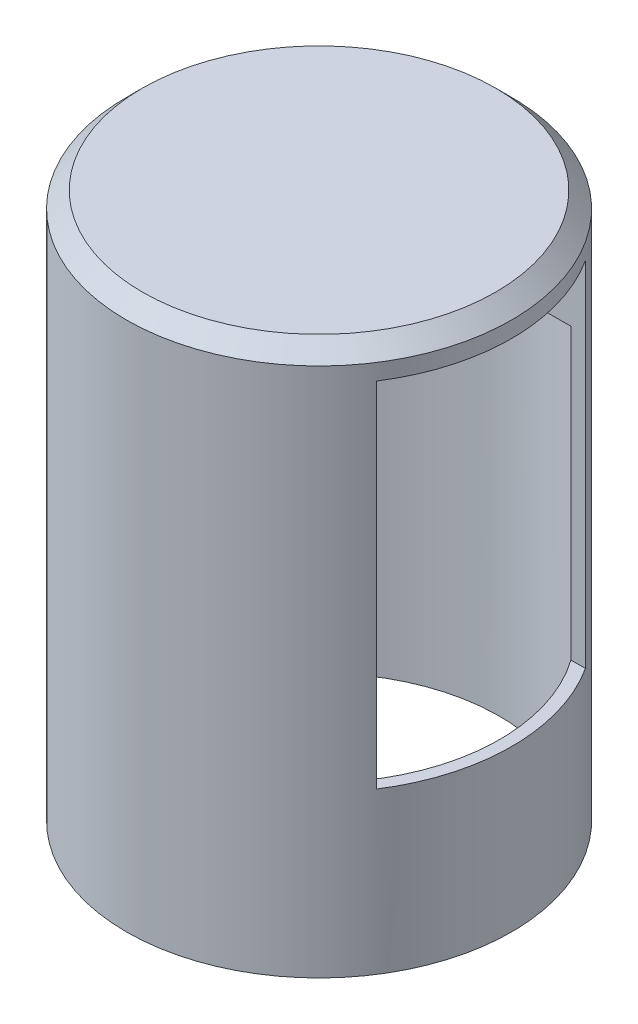
from build123d import *

# Parameters (mm, degrees)
BOSS_EXTRUDE1_DEPTH = 33
BOSS_EXTRUDE2_START = 32
BOSS_EXTRUDE2_DEPTH = 1
BOSS_EXTRUDE3_START = 33
SKETCH1_7_R         = 12
BOSS_EXTRUDE3_DEPTH = 1
CHAMFER1_SIZE       = 1
BOSS_EXTRUDE4_DEPTH = 10
BOSS_EXTRUDE5_START = 29
SKETCH1_9_W         = 2
SKETCH1_9_H         = 2
BOSS_EXTRUDE5_DEPTH = 4
BOSS_EXTRUDE6_START = 28
BOSS_EXTRUDE6_DEPTH = 5


with BuildPart() as part:
    # Sketch1 → Boss-Extrude1 (new body)
    with BuildSketch(Plane(origin=(0, 0, 0), x_dir=(1, 0, 0), z_dir=(0, 1, 0))):
        with BuildLine():
            ThreePointArc((7.383924434, -9.459263182), (8.859947089, -8.093289663), (10.087120501, -6.5))
            Line((10.087120501, -6.5), (9.182183836, -6.5))
            ThreePointArc((9.182183836, -6.5), (0, -11.25), (-9.182183836, -6.5))
            ThreePointArc((-9.182183836, -6.5), (-11.25, 0), (-9.182183836, 6.5))
            ThreePointArc((-9.182183836, 6.5), (0, 11.25), (9.182183836, 6.5))
            Line((9.182183836, 6.5), (10.087120501, 6.5))
            ThreePointArc((10.087120501, 6.5), (7.6512779, 9.244346732), (4.5, 11.124297731))
            ThreePointArc((4.5, 11.124297731), (0, 12), (-4.5, 11.124297731))
            ThreePointArc((-4.5, 11.124297731), (-10.392304845, 6), (-11.883924434, -1.665034548))
            ThreePointArc((-11.883924434, -1.665034548), (-10.392304845, -6), (-7.383924434, -9.459263182))
            ThreePointArc((-7.383924434, -9.459263182), (0, -12), (7.383924434, -9.459263182))
        make_face()
    extrude(amount=BOSS_EXTRUDE1_DEPTH)



with BuildPart() as body_2:
    # Sketch1<6> → Boss-Extrude2 (new body)
    with BuildSketch(Plane(origin=(0, 0, 0), x_dir=(1, 0, 0), z_dir=(0, 1, 0)).offset(BOSS_EXTRUDE2_START)):
        with BuildLine():
            ThreePointArc((10.087120501, -6.5), (11.248374399, -4.180200161), (11.883924434, -1.665034548))
            ThreePointArc((11.883924434, -1.665034548), (11.970945936, -0.834537834), (12, 0))
            ThreePointArc((12, 0), (11.511851415, 3.387813011), (10.087120501, 6.5))
            Line((10.087120501, 6.5), (9.182183836, 6.5))
            ThreePointArc((9.182183836, 6.5), (10.72058926, 3.410493501), (11.25, 0))
            ThreePointArc((11.25, 0), (10.72058926, -3.410493501), (9.182183836, -6.5))
            Line((9.182183836, -6.5), (10.087120501, -6.5))
        make_face()
    extrude(amount=BOSS_EXTRUDE2_DEPTH)


with BuildPart() as part_1:
    add(part.part)

    add(body_2.part)  # Boss-Extrude3 merges body 2
    # Sketch1<7> → Boss-Extrude3 (add)
    with BuildSketch(Plane(origin=(0, 0, 0), x_dir=(1, 0, 0), z_dir=(0, 1, 0)).offset(BOSS_EXTRUDE3_START)):
        with Locations(Location((0, 0, 0), (0, 0, 32.797168296))):
            Circle(SKETCH1_7_R)
    extrude(amount=BOSS_EXTRUDE3_DEPTH)

    # Chamfer1
    chamfer1_edges = [part_1.edges().sort_by_distance(p)[0] for p in [
        (-10.087120501, 34, 6.5),
    ]]
    chamfer(chamfer1_edges, length=CHAMFER1_SIZE - 0.0001)  # a hair under: the kernel refuses the full size

    # Sketch1<8> → Boss-Extrude4 (add)
    with BuildSketch(Plane(origin=(0, 0, 0), x_dir=(1, 0, 0), z_dir=(0, 1, 0))):
        with BuildLine():
            ThreePointArc((10.087120501, -6.5), (11.248374399, -4.180200161), (11.883924434, -1.665034548))
            ThreePointArc((11.883924434, -1.665034548), (11.970945936, -0.834537834), (12, 0))
            ThreePointArc((12, 0), (11.511851415, 3.387813011), (10.087120501, 6.5))
            Line((10.087120501, 6.5), (9.182183836, 6.5))
            ThreePointArc((9.182183836, 6.5), (10.72058926, 3.410493501), (11.25, 0))
            ThreePointArc((11.25, 0), (10.72058926, -3.410493501), (9.182183836, -6.5))
            Line((9.182183836, -6.5), (10.087120501, -6.5))
        make_face()
        with BuildLine():
            ThreePointArc((7.383924434, -9.459263182), (8.859947089, -8.093289663), (10.087120501, -6.5))
            Line((10.087120501, -6.5), (9.182183836, -6.5))
            ThreePointArc((9.182183836, -6.5), (0, -11.25), (-9.182183836, -6.5))
            ThreePointArc((-9.182183836, -6.5), (-11.25, 0), (-9.182183836, 6.5))
            ThreePointArc((-9.182183836, 6.5), (0, 11.25), (9.182183836, 6.5))
            Line((9.182183836, 6.5), (10.087120501, 6.5))
            ThreePointArc((10.087120501, 6.5), (7.6512779, 9.244346732), (4.5, 11.124297731))
            ThreePointArc((4.5, 11.124297731), (0, 12), (-4.5, 11.124297731))
            ThreePointArc((-4.5, 11.124297731), (-10.392304845, 6), (-11.883924434, -1.665034548))
            ThreePointArc((-11.883924434, -1.665034548), (-10.392304845, -6), (-7.383924434, -9.459263182))
            ThreePointArc((-7.383924434, -9.459263182), (0, -12), (7.383924434, -9.459263182))
        make_face()
    extrude(amount=BOSS_EXTRUDE4_DEPTH)

    # Sketch1<9> → Boss-Extrude5 (add)
    with BuildSketch(Plane(origin=(0, 0, 0), x_dir=(1, 0, 0), z_dir=(0, 1, 0)).offset(BOSS_EXTRUDE5_START)):
        with Locations((-5.154076544, -5.5)):
            Rectangle(SKETCH1_9_W, SKETCH1_9_H)
        with Locations((6.003328083, -5.5)):
            Rectangle(SKETCH1_9_W, SKETCH1_9_H)
        with Locations((6.003328083, 5.5)):
            Rectangle(SKETCH1_9_W, SKETCH1_9_H)
        with Locations((-5.154076544, 5.5)):
            Rectangle(SKETCH1_9_W, SKETCH1_9_H)
    extrude(amount=BOSS_EXTRUDE5_DEPTH)

    # Sketch1<11> → Boss-Extrude6 (add)
    with BuildSketch(Plane(origin=(0, 0, 0), x_dir=(1, 0, 0), z_dir=(0, 1, 0)).offset(BOSS_EXTRUDE6_START)):
        with BuildLine():
            ThreePointArc((-9.182183836, -6.5), (0, -11.25), (9.182183836, -6.5))
            Line((9.182183836, -6.5), (7.003328083, -6.5))
            Line((7.003328083, -6.5), (5.003328083, -6.5))
            Line((5.003328083, -6.5), (0, -6.5))
            Line((0, -6.5), (-4.154076544, -6.5))
            Line((-4.154076544, -6.5), (-6.154076544, -6.5))
            Line((-6.154076544, -6.5), (-9.182183836, -6.5))
        make_face()
        with BuildLine():
            Line((7.003328083, 6.5), (9.182183836, 6.5))
            ThreePointArc((9.182183836, 6.5), (0, 11.25), (-9.182183836, 6.5))
            Line((-9.182183836, 6.5), (-6.154076544, 6.5))
            Line((-6.154076544, 6.5), (-4.154076544, 6.5))
            Line((-4.154076544, 6.5), (0, 6.5))
            Line((0, 6.5), (5.003328083, 6.5))
            Line((5.003328083, 6.5), (7.003328083, 6.5))
        make_face()
    extrude(amount=BOSS_EXTRUDE6_DEPTH)


solid = part_1.part
